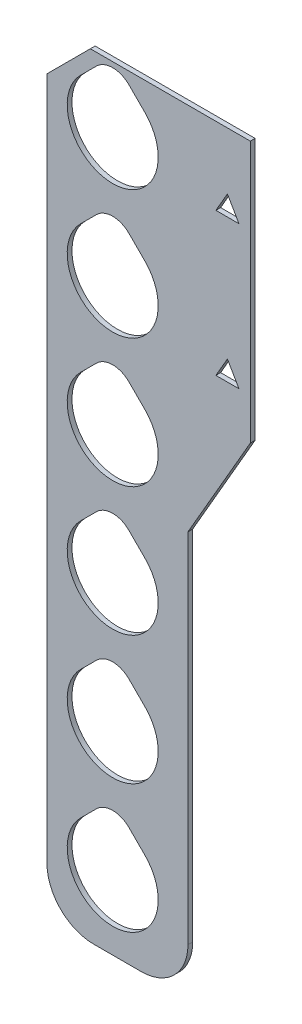
from build123d import *

# Parameters (mm, degrees)
EXTRUDE_1_DEPTH = 1


with BuildPart() as part:
    # 草图1 → 凸台-拉伸1 (new body)
    with BuildSketch(Plane.XY):
        with BuildLine():
            Line((15.8, 70.053589838), (28.876696831, 92.703093144))
            Line((28.876696831, 92.703093144), (28.876696831, 147.603847577))
            Line((28.876696831, 147.603847577), (-4.69377267, 147.603847577))
            Line((-4.69377267, 147.603847577), (-13.8, 138.497620247))
            Line((-13.8, 138.497620247), (-13.8, -5))
            ThreePointArc((-13.8, -5), (-10.929646456, -11.929646456), (-4, -14.8))
            Line((-4, -14.8), (6, -14.8))
            ThreePointArc((6, -14.8), (12.929646456, -11.929646456), (15.8, -5))
            Line((15.8, -5), (15.8, 70.053589838))
        make_face()
        with BuildLine():
            Line((-6.75286976, 6.75286976), (-3.411790219, 10.093949301))
            ThreePointArc((-3.411790219, 10.093949301), (0, 11.507159082), (3.411790219, 10.093949301))
            Line((3.411790219, 10.093949301), (6.75286976, 6.75286976))
            ThreePointArc((6.75286976, 6.75286976), (0, -9.55), (-6.75286976, 6.75286976))
        make_face(mode=Mode.SUBTRACT)
        with BuildLine():
            Line((3.411790219, 37.093949301), (6.75286976, 33.75286976))
            ThreePointArc((6.75286976, 33.75286976), (0, 17.45), (-6.75286976, 33.75286976))
            Line((-6.75286976, 33.75286976), (-3.411790219, 37.093949301))
            ThreePointArc((-3.411790219, 37.093949301), (0, 38.507159082), (3.411790219, 37.093949301))
        make_face(mode=Mode.SUBTRACT)
        with BuildLine():
            Line((3.411790219, 64.093949301), (6.75286976, 60.75286976))
            ThreePointArc((6.75286976, 60.75286976), (0, 44.45), (-6.75286976, 60.75286976))
            Line((-6.75286976, 60.75286976), (-3.411790219, 64.093949301))
            ThreePointArc((-3.411790219, 64.093949301), (0, 65.507159082), (3.411790219, 64.093949301))
        make_face(mode=Mode.SUBTRACT)
        with BuildLine():
            Line((-6.75286976, 87.75286976), (-3.411790219, 91.093949301))
            ThreePointArc((-3.411790219, 91.093949301), (0, 92.507159082), (3.411790219, 91.093949301))
            Line((3.411790219, 91.093949301), (6.75286976, 87.75286976))
            ThreePointArc((6.75286976, 87.75286976), (0, 71.45), (-6.75286976, 87.75286976))
        make_face(mode=Mode.SUBTRACT)
        with BuildLine():
            Line((-6.75286976, 114.75286976), (-3.411790219, 118.093949301))
            ThreePointArc((-3.411790219, 118.093949301), (0, 119.507159082), (3.411790219, 118.093949301))
            Line((3.411790219, 118.093949301), (6.75286976, 114.75286976))
            ThreePointArc((6.75286976, 114.75286976), (0, 98.45), (-6.75286976, 114.75286976))
        make_face(mode=Mode.SUBTRACT)
        with BuildLine():
            Line((3.411790219, 145.093949301), (6.75286976, 141.75286976))
            ThreePointArc((6.75286976, 141.75286976), (0, 125.45), (-6.75286976, 141.75286976))
            Line((-6.75286976, 141.75286976), (-3.411790219, 145.093949301))
            ThreePointArc((-3.411790219, 145.093949301), (0, 146.507159082), (3.411790219, 145.093949301))
        make_face(mode=Mode.SUBTRACT)
        Polygon((24.076696831, 105.603847577), (26.501567961, 101.403847577), (21.6518257, 101.403847577), align=None, mode=Mode.SUBTRACT)
        Polygon((26.501567961, 131.403847577), (21.6518257, 131.403847577), (24.076696831, 135.603847577), align=None, mode=Mode.SUBTRACT)
    extrude(amount=EXTRUDE_1_DEPTH)


solid = part.part
